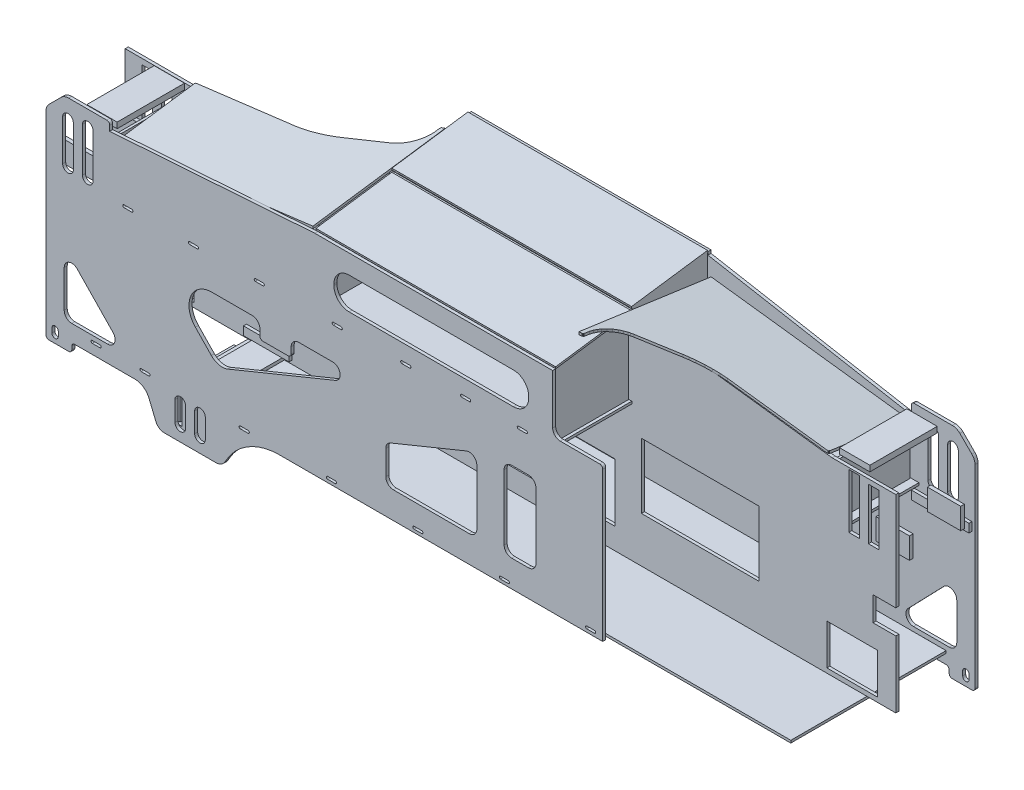
from build123d import *

# Parameters (mm, degrees)
EXTRUDE_1_DEPTH      = 260
CUT_EXTRUDE_1_DEPTH  = 600
CUT_EXTRUDE_1_DRAFT  = -7.939013706
CUT_EXTRUDE_3_DEPTH  = 600
CUT_EXTRUDE_3_TAPER  = 7.939013706
EXTRUDE_2_DEPTH      = 260
CUT_EXTRUDE_5_DEPTH  = 600
CUT_EXTRUDE_5_TAPER  = 7.939013706
CUT_EXTRUDE_10_DEPTH = 600
CUT_EXTRUDE_10_DRAFT = -7.939013706
EXTRUDE_3_DEPTH      = 10
SKETCH_20_W          = 690
SKETCH_20_H          = 192.4
SKETCH_20_W_2        = 642
SKETCH_20_H_2        = 130
SKETCH_20_W_3        = 388.2
SKETCH_20_H_3        = 214.6
SKETCH_20_W_4        = 167.3
SKETCH_20_H_4        = 133.9
SKETCH_20_W_5        = 35
SKETCH_20_H_5        = 180
SKETCH_20_H_6        = 170
SKETCH_20_W_6        = 75
SKETCH_20_H_7        = 80
CUT_EXTRUDE_14_DEPTH = 10
SKETCH_22_W          = 2040
SKETCH_22_H          = 8
EXTRUDE_4_DEPTH      = 512
EXTRUDE_5_DEPTH      = 251
EXTRUDE_6_DEPTH      = 251
EXTRUDE_7_DEPTH      = 790
EXTRUDE_8_DEPTH      = 790
EXTRUDE_10_DEPTH     = 10
SKETCH_35_R          = 110
SKETCH_35_R_2        = 40
CUT_EXTRUDE_18_DEPTH = 10
EXTRUDE_12_DEPTH     = 10
CUT_EXTRUDE_20_DEPTH = 10
EXTRUDE_13_DEPTH     = 8
EXTRUDE_14_DEPTH     = 8
EXTRUDE_15_DEPTH     = 8
SKETCH_47_W          = 243
SKETCH_47_H          = 172.5
EXTRUDE_16_DEPTH     = 8
SKETCH_49_W          = 243
SKETCH_49_H          = 172.5
EXTRUDE_17_DEPTH     = 8
SKETCH_53_W          = 222
SKETCH_53_H          = 19
EXTRUDE_18_DEPTH     = 100
SKETCH_55_W          = 222
SKETCH_55_H          = 19
EXTRUDE_19_DEPTH     = 100
SKETCH_57_W          = 110
SKETCH_57_H          = 70
EXTRUDE_20_DEPTH     = 12
SKETCH_59_W          = 110
SKETCH_59_H          = 70
EXTRUDE_21_DEPTH     = 12
SKETCH_61_W          = 110
SKETCH_61_H          = 70
EXTRUDE_22_DEPTH     = 12
SKETCH_63_W          = 110
SKETCH_63_H          = 70
EXTRUDE_23_DEPTH     = 12
SKETCH_65_W          = 170
SKETCH_65_H          = 206
EXTRUDE_24_DEPTH     = 10
SKETCH_70_W          = 9
SKETCH_70_H          = 130
EXTRUDE_25_DEPTH     = 120
SKETCH_72_W          = 188
SKETCH_72_H          = 122
EXTRUDE_26_DEPTH     = 10
SKETCH_74_W          = 188
SKETCH_74_H          = 122
EXTRUDE_27_DEPTH     = 10
SKETCH_76_W          = 188
SKETCH_76_H          = 122
EXTRUDE_28_DEPTH     = 10
CUT_EXTRUDE_26_DEPTH = 170
SKETCH_80_W          = 170
SKETCH_80_H          = 206
EXTRUDE_29_DEPTH     = 10
SKETCH_82_W          = 9
SKETCH_82_H          = 130
EXTRUDE_30_DEPTH     = 120
SKETCH_84_W          = 188
SKETCH_84_H          = 122
EXTRUDE_31_DEPTH     = 10
SKETCH_86_W          = 188
SKETCH_86_H          = 122
EXTRUDE_32_DEPTH     = 10
SKETCH_88_W          = 188
SKETCH_88_H          = 122
EXTRUDE_33_DEPTH     = 10
CUT_EXTRUDE_28_DEPTH = 170
SKETCH_92_W          = 150
SKETCH_92_H          = 28
EXTRUDE_34_DEPTH     = 10
SKETCH_94_W          = 150
SKETCH_94_H          = 28
EXTRUDE_35_DEPTH     = 10
SKETCH_96_W          = 150
SKETCH_96_H          = 28
EXTRUDE_36_DEPTH     = 10
SKETCH_98_W          = 150
SKETCH_98_H          = 28
EXTRUDE_38_DEPTH     = 10
SKETCH_99_W          = 190
SKETCH_99_H          = 28
EXTRUDE_39_DEPTH     = 10
SKETCH_100_W         = 190
SKETCH_100_H         = 28
EXTRUDE_40_DEPTH     = 10
SKETCH_101_W         = 190
SKETCH_101_H         = 28
EXTRUDE_41_DEPTH     = 10
SKETCH_102_W         = 190
SKETCH_102_H         = 28
EXTRUDE_43_DEPTH     = 10
SKETCH_104_W         = 100
SKETCH_104_H         = 251
EXTRUDE_44_DEPTH     = 10
SKETCH_105_W         = 100
SKETCH_105_H         = 251
EXTRUDE_46_DEPTH     = 10


with BuildPart() as part:
    # ｽｹｯﾁ2 → ﾎﾞｽ - 押し出し1 (new body)
    with BuildSketch(Plane(origin=(0, 700, 0), x_dir=(1, 0, 0), z_dir=(0, 1, 0))):
        Polygon((859.401578498, -89.242522878), (858.18844544, -92.043316668), (857.942098107, -109.59892495), (856.562944919, -120.633623225), (853.948200176, -131.420332107), (850.130416699, -141.825566927), (844.029861893, -153.62310181), (836.379229932, -164.464704914), (827.407372342, -174.070028252), (818.443138759, -181.486675677), (808.645526953, -187.779306007), (803.476676344, -190.47592951), (795.4371, -193.931622), (677.849128501, -238.310910325), (663.164273166, -243.339007562), (646.141609469, -248.370559614), (622.378346519, -254.026187714), (600.487925624, -257.882125504), (578.394815702, -260.501266552), (556.165277331, -261.87564156), (224.195193131, -262.101718981), (223.745858592, -263.826086479), (222.475446, -265.792122), (222.475446, -522), (869.5, -521.843193568), (869.5, -85.695096947), (861.419191022, -87.896224679), (859.520417297, -89.114243261), align=None)
    extrude(amount=EXTRUDE_1_DEPTH)


with BuildPart() as cut_extrude_1_tool:
    # ｽｹｯﾁ3 → ｶｯﾄ - 押し出し1 (with draft: the straight prism first)
    with BuildSketch(Plane.XY):
        Polygon((150, 808.1685), (950, 908.1685), (950, 1300), (150, 1300), align=None)
    extrude(amount=CUT_EXTRUDE_1_DEPTH)
    # ｶｯﾄ - 押し出し1: the draft: its side faces are tilted about the plane it starts from
    cut_extrude_1_sides = [cut_extrude_1_tool.faces().sort_by_distance(p)[0] for p in [
        (550, 858.1685, 300),
        (950, 1104.08425, 300),
        (550, 1300, 300),
        (150, 1054.08425, 300),
    ]]
    draft(cut_extrude_1_sides, Plane.XY, CUT_EXTRUDE_1_DRAFT)


with BuildPart() as part_1:
    add(part.part)

    # ｶｯﾄ - 押し出し1: cut by cut_extrude_1_tool
    add(cut_extrude_1_tool.part, mode=Mode.SUBTRACT)

    # ｽｹｯﾁ5 → ｶｯﾄ - 押し出し3 (cut)
    with BuildSketch(Plane.XY):
        Polygon((150, 800.028222948), (150, 300), (950, 300), (950, 900.028222948), align=None)
    extrude(amount=CUT_EXTRUDE_3_DEPTH, taper=CUT_EXTRUDE_3_TAPER, mode=Mode.SUBTRACT)

    # ｽｹｯﾁ15 → ﾎﾞｽ - 押し出し3 (add)
    with BuildSketch(Plane.XY.offset(261)):
        Polygon((0, 145), (2540, 145), (2540, 768.5), (2330, 768.5), (1660, 853), (880, 853), (218, 771.3), (0, 771.3), align=None)
    extrude(amount=EXTRUDE_3_DEPTH)

    # ｽｹｯﾁ20 → ｶｯﾄ - 押し出し14 (cut)
    with BuildSketch(Plane.XY.offset(261)):
        with Locations((1270, 311.2)):
            Rectangle(SKETCH_20_W, SKETCH_20_H)
        with Locations((1270, 725)):
            Rectangle(SKETCH_20_W_2, SKETCH_20_H_2)
        with Locations((644.6, 402.7)):
            Rectangle(SKETCH_20_W_3, SKETCH_20_H_3)
        with Locations((1895.4, 402.7)):
            Rectangle(SKETCH_20_W_3, SKETCH_20_H_3)
        with Locations((143.65, 226.95)):
            Rectangle(SKETCH_20_W_4, SKETCH_20_H_4)
        with Locations((2396.35, 226.95)):
            Rectangle(SKETCH_20_W_4, SKETCH_20_H_4)
        with Locations((2402.5, 673)):
            Rectangle(SKETCH_20_W_5, SKETCH_20_H_5)
        with Locations((137.5, 673)):
            Rectangle(SKETCH_20_W_5, SKETCH_20_H_5)
        with Locations((2467.5, 668)):
            Rectangle(SKETCH_20_W_5, SKETCH_20_H_6)
        with Locations((72.5, 668)):
            Rectangle(SKETCH_20_W_5, SKETCH_20_H_6)
        with Locations((37.5, 405)):
            Rectangle(SKETCH_20_W_6, SKETCH_20_H_7)
        with Locations((2502.5, 405)):
            Rectangle(SKETCH_20_W_6, SKETCH_20_H_7)
    extrude(amount=CUT_EXTRUDE_14_DEPTH, mode=Mode.SUBTRACT)

    # ｽｹｯﾁ22 → ﾎﾞｽ - 押し出し4 (add)
    with BuildSketch(Plane.XY.offset(10)):
        with Locations((1425, 141)):
            Rectangle(SKETCH_22_W, SKETCH_22_H)
    extrude(amount=EXTRUDE_4_DEPTH)

    # ｽｹｯﾁ23 → ﾎﾞｽ - 押し出し5 (add)
    with BuildSketch(Plane.XY.offset(10)):
        Polygon((870, 592.085859052), (2355, 571.35), (2355, 579.35), (870, 600.085859052), align=None)
    extrude(amount=EXTRUDE_5_DEPTH)

    # ｽｹｯﾁ25 → ﾎﾞｽ - 押し出し6 (add)
    with BuildSketch(Plane.XY.offset(271)):
        Polygon((185, 571.35), (1670, 592.085859052), (1670, 600.085859052), (185, 579.35), align=None)
    extrude(amount=EXTRUDE_6_DEPTH)

    # ｽｹｯﾁ31 → ﾎﾞｽ - 押し出し10 (add)
    with BuildSketch(Plane.XY):
        with BuildLine():
            Line((1770.99897, 127.000046), (869.999772, 127.000044))
            Line((869.999772, 127.000044), (869.999764, 544.000032))
            ThreePointArc((869.999764, 544.000032), (867.070831812, 551.071099812), (859.999764, 554.000032))
            Line((859.999764, 554.000032), (714.999756, 554.00003))
            ThreePointArc((714.999756, 554.00003), (707.928688188, 556.928962188), (704.999756, 564.00003))
            Line((704.999756, 564.00003), (704.999756, 619.000038))
            ThreePointArc((704.999756, 619.000038), (707.928688188, 626.071105812), (714.999756, 629.000038))
            Line((714.999756, 629.000038), (859.999764, 629.000036))
            ThreePointArc((859.999764, 629.000036), (867.070831812, 631.928968188), (869.999764, 639.000036))
            Line((869.999764, 639.000036), (869.999772, 891.50004))
            Line((869.999772, 891.50004), (1659.999756, 891.50004))
            Line((1659.999756, 891.50004), (1659.999756, 889.000038))
            Line((1659.999756, 889.000038), (1659.999756, 881.325972))
            Line((1659.999756, 881.325972), (2329.99977, 760.325976))
            Line((2329.99977, 760.325976), (2329.99976, 788.00004))
            ThreePointArc((2329.99976, 788.00004), (2332.928692188, 795.071107812), (2339.99976, 798.00004))
            Line((2339.99976, 798.00004), (2465.502294, 798.000038))
            ThreePointArc((2465.502294, 798.000038), (2478.896214133, 795.335821638), (2490.251031342, 787.748775342))
            Line((2490.251031342, 787.748775342), (2529.748503342, 748.251303342))
            ThreePointArc((2529.748503342, 748.251303342), (2537.335549638, 736.896486133), (2539.999766, 723.502566))
            Line((2539.999766, 723.502566), (2539.999768, 85.000032))
            ThreePointArc((2539.999768, 85.000032), (2537.070835812, 77.928964188), (2529.999768, 75.000032))
            Line((2529.999768, 75.000032), (2464.99977, 75.000032))
            ThreePointArc((2464.99977, 75.000032), (2457.928702188, 77.928964188), (2454.99977, 85.000032))
            Line((2454.99977, 85.000032), (2454.999772, 95.00004))
            ThreePointArc((2454.999772, 95.00004), (2452.070839812, 102.071107812), (2444.999772, 105.00004))
            Line((2444.999772, 105.00004), (2246.946474, 105.000044))
            ThreePointArc((2246.946474, 105.000044), (2219.167962349, 96.573524615), (2200.752497374, 74.134215618))
            Line((2200.752497374, 74.134215618), (2177.716155975, 18.519539029))
            ThreePointArc((2177.716155975, 18.519539029), (2166.666876991, 5.055953631), (2149.99977, 4.2e-05))
            Line((2149.99977, 4.2e-05), (1979.99976, 4.6e-05))
            ThreePointArc((1979.99976, 4.6e-05), (1962.49976, 4.689156868), (1949.688870868, 17.500046))
            Line((1949.688870868, 17.500046), (1944.204050757, 27.000046))
            ThreePointArc((1944.204050757, 27.000046), (1870.99897, 100.205126757), (1770.99897, 127.000046))
        make_face()
    extrude(amount=EXTRUDE_10_DEPTH)

    # ｽｹｯﾁ35 → ｶｯﾄ - 押し出し18 (cut)
    with BuildSketch(Plane.XY):
        with Locations((1069.99977, 730.000044)):
            Circle(SKETCH_35_R)
        with Locations((1719.999768, 648.223074)):
            Circle(SKETCH_35_R_2)
        with BuildLine():
            Line((2479.999762, 306.830088), (2479.999762, 185.00004))
            ThreePointArc((2479.999762, 185.00004), (2472.67743153, 167.32237047), (2454.999762, 160.00004))
            Line((2454.999762, 160.00004), (2337.304944, 160.00004))
            ThreePointArc((2337.304944, 160.00004), (2323.505525341, 164.153552414), (2314.291391219, 175.233956426))
            ThreePointArc((2314.291391219, 175.233956426), (2312.724223269, 189.559444387), (2319.324761616, 202.36992893))
            Line((2319.324761616, 202.36992893), (2437.019579616, 324.19997693))
            ThreePointArc((2437.019579616, 324.19997693), (2449.805467814, 331.284521298), (2464.36713731, 330.008791152))
            ThreePointArc((2464.36713731, 330.008791152), (2475.726367882, 320.808922308), (2479.999762, 306.830088))
        make_face()
        with BuildLine():
            Line((2419.999756, 745.500039924), (2419.999756, 600.500036076))
            ThreePointArc((2419.999756, 600.500036076), (2414.874106313, 588.125700971), (2402.499756, 583.000088))
            ThreePointArc((2402.499756, 583.000088), (2390.125405687, 588.125700971), (2384.999756, 600.500036076))
            Line((2384.999756, 600.500036076), (2384.999756, 745.500039924))
            ThreePointArc((2384.999756, 745.500039924), (2390.125405687, 757.874375029), (2402.499756, 762.999988))
            ThreePointArc((2402.499756, 762.999988), (2414.874106313, 757.874375029), (2419.999756, 745.500039924))
        make_face()
        with BuildLine():
            Line((2484.999772, 735.500031924), (2484.999772, 600.500036076))
            ThreePointArc((2484.999772, 600.500036076), (2479.874122313, 588.125700971), (2467.499772, 583.000088))
            ThreePointArc((2467.499772, 583.000088), (2455.125421687, 588.125700971), (2449.999772, 600.500036076))
            Line((2449.999772, 600.500036076), (2449.999772, 735.500031924))
            ThreePointArc((2449.999772, 735.500031924), (2455.125421687, 747.874367029), (2467.499772, 752.99998))
            ThreePointArc((2467.499772, 752.99998), (2479.874122313, 747.874367029), (2484.999772, 735.500031924))
        make_face()
        with BuildLine():
            Line((2014.999766, 47.500040076), (2014.999766, 112.500033924))
            ThreePointArc((2014.999766, 112.500033924), (2020.125415687, 124.874369029), (2032.499766, 129.999982))
            ThreePointArc((2032.499766, 129.999982), (2044.874116313, 124.874369029), (2049.999766, 112.500033924))
            Line((2049.999766, 112.500033924), (2049.999766, 47.500040076))
            ThreePointArc((2049.999766, 47.500040076), (2044.874116313, 35.125704971), (2032.499766, 30.000092))
            ThreePointArc((2032.499766, 30.000092), (2020.125415687, 35.125704971), (2014.999766, 47.500040076))
        make_face()
        with BuildLine():
            Line((2079.999764, 47.500040076), (2079.999764, 112.500033924))
            ThreePointArc((2079.999764, 112.500033924), (2085.125413687, 124.874369029), (2097.499764, 129.999982))
            ThreePointArc((2097.499764, 129.999982), (2109.874114313, 124.874369029), (2114.999764, 112.500033924))
            Line((2114.999764, 112.500033924), (2114.999764, 47.500040076))
            ThreePointArc((2114.999764, 47.500040076), (2109.874114313, 35.125704971), (2097.499764, 30.000092))
            ThreePointArc((2097.499764, 30.000092), (2085.125413687, 35.125704971), (2079.999764, 47.500040076))
        make_face()
        with BuildLine():
            Line((2499.49977, 100.000044), (2499.49977, 115.000038))
            ThreePointArc((2499.49977, 115.000038), (2502.575148798, 122.424659202), (2509.99977, 125.500038))
            ThreePointArc((2509.99977, 125.500038), (2517.424391202, 122.424659202), (2520.49977, 115.000038))
            Line((2520.49977, 115.000038), (2520.49977, 100.000044))
            ThreePointArc((2520.49977, 100.000044), (2517.424391202, 92.575422798), (2509.99977, 89.500044))
            ThreePointArc((2509.99977, 89.500044), (2502.575148798, 92.575422798), (2499.49977, 100.000044))
        make_face()
        with BuildLine():
            Line((907.35, 136.85), (932.65, 136.85))
            ThreePointArc((932.65, 136.85), (935.584493142, 138.065506858), (936.8, 141))
            ThreePointArc((936.8, 141), (935.584493142, 143.934493142), (932.65, 145.15))
            Line((932.65, 145.15), (907.35, 145.15))
            ThreePointArc((907.35, 145.15), (904.415506858, 143.934493142), (903.2, 141))
            ThreePointArc((903.2, 141), (904.415506858, 138.065506858), (907.35, 136.85))
        make_face()
        with BuildLine():
            Line((1148.35, 136.85), (1173.65, 136.85))
            ThreePointArc((1173.65, 136.85), (1176.584493142, 138.065506858), (1177.8, 141))
            ThreePointArc((1177.8, 141), (1176.584493142, 143.934493142), (1173.65, 145.15))
            Line((1173.65, 145.15), (1148.35, 145.15))
            ThreePointArc((1148.35, 145.15), (1145.415506858, 143.934493142), (1144.2, 141))
            ThreePointArc((1144.2, 141), (1145.415506858, 138.065506858), (1148.35, 136.85))
        make_face()
        with BuildLine():
            Line((1390.35, 136.85), (1415.65, 136.85))
            ThreePointArc((1415.65, 136.85), (1418.584493142, 138.065506858), (1419.8, 141))
            ThreePointArc((1419.8, 141), (1418.584493142, 143.934493142), (1415.65, 145.15))
            Line((1415.65, 145.15), (1390.35, 145.15))
            ThreePointArc((1390.35, 145.15), (1387.415506858, 143.934493142), (1386.2, 141))
            ThreePointArc((1386.2, 141), (1387.415506858, 138.065506858), (1390.35, 136.85))
        make_face()
        with BuildLine():
            Line((1632.35, 136.85), (1657.65, 136.85))
            ThreePointArc((1657.65, 136.85), (1660.584493142, 138.065506858), (1661.8, 141))
            ThreePointArc((1661.8, 141), (1660.584493142, 143.934493142), (1657.65, 145.15))
            Line((1657.65, 145.15), (1632.35, 145.15))
            ThreePointArc((1632.35, 145.15), (1629.415506858, 143.934493142), (1628.2, 141))
            ThreePointArc((1628.2, 141), (1629.415506858, 138.065506858), (1632.35, 136.85))
        make_face()
        with BuildLine():
            Line((1873.85, 136.85), (1899.15, 136.85))
            ThreePointArc((1899.15, 136.85), (1902.084493142, 138.065506858), (1903.3, 141))
            ThreePointArc((1903.3, 141), (1902.084493142, 143.934493142), (1899.15, 145.15))
            Line((1899.15, 145.15), (1873.85, 145.15))
            ThreePointArc((1873.85, 145.15), (1870.915506858, 143.934493142), (1869.7, 141))
            ThreePointArc((1869.7, 141), (1870.915506858, 138.065506858), (1873.85, 136.85))
        make_face()
        with BuildLine():
            Line((2200.85, 136.85), (2226.15, 136.85))
            ThreePointArc((2226.15, 136.85), (2229.084493142, 138.065506858), (2230.3, 141))
            ThreePointArc((2230.3, 141), (2229.084493142, 143.934493142), (2226.15, 145.15))
            Line((2226.15, 145.15), (2200.85, 145.15))
            ThreePointArc((2200.85, 145.15), (2197.915506858, 143.934493142), (2196.7, 141))
            ThreePointArc((2196.7, 141), (2197.915506858, 138.065506858), (2200.85, 136.85))
        make_face()
        with BuildLine():
            Line((2362.35, 136.85), (2387.65, 136.85))
            ThreePointArc((2387.65, 136.85), (2390.584493142, 138.065506858), (2391.8, 141))
            ThreePointArc((2391.8, 141), (2390.584493142, 143.934493142), (2387.65, 145.15))
            Line((2387.65, 145.15), (2362.35, 145.15))
            ThreePointArc((2362.35, 145.15), (2359.415506858, 143.934493142), (2358.2, 141))
            ThreePointArc((2358.2, 141), (2359.415506858, 138.065506858), (2362.35, 136.85))
        make_face()
        with BuildLine():
            Line((907.35, 595.351), (932.65, 595.351))
            ThreePointArc((932.65, 595.351), (935.584493142, 596.566506858), (936.8, 599.501))
            ThreePointArc((936.8, 599.501), (935.584493142, 602.435493142), (932.65, 603.651))
            Line((932.65, 603.651), (907.35, 603.651))
            ThreePointArc((907.35, 603.651), (904.415506858, 602.435493142), (903.2, 599.501))
            ThreePointArc((903.2, 599.501), (904.415506858, 596.566506858), (907.35, 595.351))
        make_face()
        with BuildLine():
            Line((1132.35, 592.209), (1157.65, 592.209))
            ThreePointArc((1157.65, 592.209), (1160.584493142, 593.424506858), (1161.8, 596.359))
            ThreePointArc((1161.8, 596.359), (1160.584493142, 599.293493142), (1157.65, 600.509))
            Line((1157.65, 600.509), (1132.35, 600.509))
            ThreePointArc((1132.35, 600.509), (1129.415506858, 599.293493142), (1128.2, 596.359))
            ThreePointArc((1128.2, 596.359), (1129.415506858, 593.424506858), (1132.35, 592.209))
        make_face()
        with BuildLine():
            Line((1329.35, 589.458), (1354.65, 589.458))
            ThreePointArc((1354.65, 589.458), (1357.584493142, 590.673506858), (1358.8, 593.608))
            ThreePointArc((1358.8, 593.608), (1357.584493142, 596.542493142), (1354.65, 597.758))
            Line((1354.65, 597.758), (1329.35, 597.758))
            ThreePointArc((1329.35, 597.758), (1326.415506858, 596.542493142), (1325.2, 593.608))
            ThreePointArc((1325.2, 593.608), (1326.415506858, 590.673506858), (1329.35, 589.458))
        make_face()
        with BuildLine():
            Line((1603.35, 585.632), (1628.65, 585.632))
            ThreePointArc((1628.65, 585.632), (1631.584493142, 586.847506858), (1632.8, 589.782))
            ThreePointArc((1632.8, 589.782), (1631.584493142, 592.716493142), (1628.65, 593.932))
            Line((1628.65, 593.932), (1603.35, 593.932))
            ThreePointArc((1603.35, 593.932), (1600.415506858, 592.716493142), (1599.2, 589.782))
            ThreePointArc((1599.2, 589.782), (1600.415506858, 586.847506858), (1603.35, 585.632))
        make_face()
        with BuildLine():
            Line((1808.35, 582.77), (1833.65, 582.77))
            ThreePointArc((1833.65, 582.77), (1836.584493142, 583.985506858), (1837.8, 586.92))
            ThreePointArc((1837.8, 586.92), (1836.584493142, 589.854493142), (1833.65, 591.07))
            Line((1833.65, 591.07), (1808.35, 591.07))
            ThreePointArc((1808.35, 591.07), (1805.415506858, 589.854493142), (1804.2, 586.92))
            ThreePointArc((1804.2, 586.92), (1805.415506858, 583.985506858), (1808.35, 582.77))
        make_face()
        with BuildLine():
            Line((2033.35, 579.628), (2058.65, 579.628))
            ThreePointArc((2058.65, 579.628), (2061.584493142, 580.843506858), (2062.8, 583.778))
            ThreePointArc((2062.8, 583.778), (2061.584493142, 586.712493142), (2058.65, 587.928))
            Line((2058.65, 587.928), (2033.35, 587.928))
            ThreePointArc((2033.35, 587.928), (2030.415506858, 586.712493142), (2029.2, 583.778))
            ThreePointArc((2029.2, 583.778), (2030.415506858, 580.843506858), (2033.35, 579.628))
        make_face()
        with BuildLine():
            Line((2257.35, 576.5), (2282.65, 576.5))
            ThreePointArc((2282.65, 576.5), (2285.584493142, 577.715506858), (2286.8, 580.65))
            ThreePointArc((2286.8, 580.65), (2285.584493142, 583.584493142), (2282.65, 584.8))
            Line((2282.65, 584.8), (2257.35, 584.8))
            ThreePointArc((2257.35, 584.8), (2254.415506858, 583.584493142), (2253.2, 580.65))
            ThreePointArc((2253.2, 580.65), (2254.415506858, 577.715506858), (2257.35, 576.5))
        make_face()
    extrude(amount=CUT_EXTRUDE_18_DEPTH, mode=Mode.SUBTRACT)



with BuildPart() as body_2:
    # ｽｹｯﾁ6 → ﾎﾞｽ - 押し出し2 (new body)
    with BuildSketch(Plane(origin=(0, 700, 0), x_dir=(1, 0, 0), z_dir=(0, 1, 0))):
        Polygon((1680.598421502, -442.757477122), (1681.81155456, -439.956683332), (1682.057901893, -422.40107505), (1683.437055081, -411.366376775), (1686.051799824, -400.579667893), (1689.869583301, -390.174433073), (1695.970138107, -378.37689819), (1703.620770068, -367.535295086), (1712.592627658, -357.929971748), (1721.556861241, -350.513324323), (1731.354473047, -344.220693993), (1736.523323656, -341.52407049), (1744.5629, -338.068378), (1862.150871499, -293.689089675), (1876.835726834, -288.660992438), (1893.858390531, -283.629440386), (1917.621653481, -277.973812286), (1939.512074376, -274.117874496), (1961.605184298, -271.498733448), (1983.834722669, -270.12435844), (2315.804806869, -269.898281019), (2316.254141408, -268.173913521), (2317.524554, -266.207878), (2317.524554, -10), (1670.5, -10.156806432), (1670.5, -446.304903053), (1678.580808978, -444.103775321), (1680.479582703, -442.885756739), align=None)
    extrude(amount=EXTRUDE_2_DEPTH)

    # ｽｹｯﾁ8 → ｶｯﾄ - 押し出し5 (cut)
    with BuildSketch(Plane.XY):
        Polygon((1590, 833.401), (2390, 733.401), (2390, 1300), (1590, 1300), align=None)
    extrude(amount=CUT_EXTRUDE_5_DEPTH, taper=CUT_EXTRUDE_5_TAPER, mode=Mode.SUBTRACT)


with BuildPart() as cut_extrude_10_tool:
    # ｽｹｯﾁ13 → ｶｯﾄ - 押し出し10 (with draft: the straight prism first)
    with BuildSketch(Plane.XY):
        Polygon((1590, 825.260722948), (1590, 300), (2390, 300), (2390, 725.260722948), align=None)
    extrude(amount=CUT_EXTRUDE_10_DEPTH)
    # ｶｯﾄ - 押し出し10: the draft: its side faces are tilted about the plane it starts from
    cut_extrude_10_sides = [cut_extrude_10_tool.faces().sort_by_distance(p)[0] for p in [
        (1590, 562.630361474, 300),
        (1990, 300, 300),
        (2390, 512.630361474, 300),
        (1990, 775.260722948, 300),
    ]]
    draft(cut_extrude_10_sides, Plane.XY, CUT_EXTRUDE_10_DRAFT)


with BuildPart() as body_2_1:
    add(body_2.part)

    # ｶｯﾄ - 押し出し10: cut by cut_extrude_10_tool
    add(cut_extrude_10_tool.part, mode=Mode.SUBTRACT)


with BuildPart() as body_3:
    # ｽｹｯﾁ27 → ﾎﾞｽ - 押し出し7 (new body)
    with BuildSketch(Plane(origin=(870, 0, 0), x_dir=(0, 0, -1), z_dir=(1, 0, 0))):
        Polygon((-11.335, 895.757969639), (-261.873, 860.547149994), (-261.037961394, 854.605541582), (-10.499961394, 889.816361226), align=None)
    extrude(amount=EXTRUDE_7_DEPTH)



with BuildPart() as body_4:
    # ｽｹｯﾁ29 → ﾎﾞｽ - 押し出し8 (new body)
    with BuildSketch(Plane(origin=(880, 0, 0), x_dir=(0, 0, -1), z_dir=(1, 0, 0))):
        Polygon((-272.292, 859.082855037), (-522.335, 823.941603106), (-521.499961394, 817.999994693), (-271.456961394, 853.141246625), align=None)
    extrude(amount=EXTRUDE_8_DEPTH)


with BuildPart() as body_5:
    # ｽｹｯﾁ37 → ﾎﾞｽ - 押し出し12 (new body)
    with BuildSketch(Plane.XY.offset(522)):
        with BuildLine():
            Line((769.000788, 127.000046), (1834.999992, 127.000044))
            Line((1834.999992, 127.000044), (1834.999984, 619.000038))
            ThreePointArc((1834.999984, 619.000038), (1832.071051812, 626.071105812), (1824.999984, 629.000038))
            Line((1824.999984, 629.000038), (1694.999988, 629.00003))
            ThreePointArc((1694.999988, 629.00003), (1677.32231847, 636.32236047), (1669.999988, 654.00003))
            Line((1669.999988, 654.00003), (1669.999986, 818.000046))
            Line((1669.999986, 818.000046), (886.199994, 818.000046))
            Line((886.199994, 818.000046), (209.999988, 770.800032))
            Line((209.999988, 770.800032), (209.999998, 788.00004))
            ThreePointArc((209.999998, 788.00004), (207.071065812, 795.071107812), (199.999998, 798.00004))
            Line((199.999998, 798.00004), (74.497464, 798.000038))
            ThreePointArc((74.497464, 798.000038), (61.103543867, 795.335821638), (49.748726658, 787.748775342))
            Line((49.748726658, 787.748775342), (10.251254658, 748.251303342))
            ThreePointArc((10.251254658, 748.251303342), (2.664208362, 736.896486133), (-8e-06, 723.502566))
            Line((-8e-06, 723.502566), (-1e-05, 85.000032))
            ThreePointArc((-1e-05, 85.000032), (2.928922188, 77.928964188), (9.99999, 75.000032))
            Line((9.99999, 75.000032), (74.999988, 75.000032))
            ThreePointArc((74.999988, 75.000032), (82.071055812, 77.928964188), (84.999988, 85.000032))
            Line((84.999988, 85.000032), (84.999986, 95.00004))
            ThreePointArc((84.999986, 95.00004), (87.928918188, 102.071107812), (94.999986, 105.00004))
            Line((94.999986, 105.00004), (293.053284, 105.000044))
            ThreePointArc((293.053284, 105.000044), (320.831795651, 96.573524615), (339.247260626, 74.134215618))
            Line((339.247260626, 74.134215618), (362.283602025, 18.519539029))
            ThreePointArc((362.283602025, 18.519539029), (373.332881009, 5.055953631), (389.999988, 4.2e-05))
            Line((389.999988, 4.2e-05), (559.999998, 4.6e-05))
            ThreePointArc((559.999998, 4.6e-05), (577.499998, 4.689156868), (590.310887132, 17.500046))
            Line((590.310887132, 17.500046), (595.795707243, 27.000046))
            ThreePointArc((595.795707243, 27.000046), (669.000788, 100.205126757), (769.000788, 127.000046))
        make_face()
    extrude(amount=EXTRUDE_12_DEPTH)

    # ｽｹｯﾁ39 → ｶｯﾄ - 押し出し20 (cut)
    with BuildSketch(Plane.XY.offset(522)):
        with BuildLine():
            Line((1590.999998, 700.000044981), (1590.999998, 705.000047236))
            ThreePointArc((1590.999998, 705.000047236), (1576.355335208, 740.355382911), (1540.999998, 755.000042))
            Line((1540.999998, 755.000042), (999, 755.000042))
            ThreePointArc((999, 755.000042), (963.644660941, 740.355381059), (949, 705.000042))
            Line((949, 705.000042), (949, 700.000043236))
            ThreePointArc((949, 700.000043236), (963.644659089, 664.644700792), (999, 650.000038))
            Line((999, 650.000038), (1541.000004109, 650.000038))
            ThreePointArc((1541.000004109, 650.000038), (1576.355341687, 664.644703569), (1590.999998, 700.000044981))
        make_face()
        with BuildLine():
            Line((492.389512848, 352.89036921), (544.869989232, 298.56598814))
            ThreePointArc((544.869989232, 298.56598814), (570.539750908, 284.376189178), (599.750661652, 287.023782914))
            Line((599.750661652, 287.023782914), (954.039979826, 431.859048457))
            ThreePointArc((954.039979826, 431.859048457), (966.586843624, 443.138708908), (969.110671772, 459.820579982))
            ThreePointArc((969.110671772, 459.820579982), (960.46199368, 474.306949379), (944.579826, 480.00004))
            Line((944.579826, 480.00004), (832.999986, 480.00004))
            ThreePointArc((832.999986, 480.00004), (815.32231647, 472.67770953), (807.999986, 455.00004))
            Line((807.999986, 455.00004), (807.999994, 434.000034))
            ThreePointArc((807.999994, 434.000034), (805.071061812, 426.928966188), (797.999994, 424.000034))
            Line((797.999994, 424.000034), (714.999996, 424.000034))
            ThreePointArc((714.999996, 424.000034), (707.928928188, 426.928966188), (704.999996, 434.000034))
            Line((704.999996, 434.000034), (704.999986, 455.00004))
            ThreePointArc((704.999986, 455.00004), (697.67765553, 472.67770953), (679.999986, 480.00004))
            Line((679.999986, 480.00004), (546.33006, 480.000036))
            ThreePointArc((546.33006, 480.000036), (504.931804023, 467.539498758), (477.289401656, 434.298286722))
            ThreePointArc((477.289401656, 434.298286722), (472.587897808, 391.321822839), (492.389512848, 352.89036921))
        make_face()
        with BuildLine():
            Line((1119.999998, 320.866002), (1119.999998, 240.00003))
            ThreePointArc((1119.999998, 240.00003), (1127.32232847, 222.32236047), (1144.999998, 215.00003))
            Line((1144.999998, 215.00003), (1395, 215.00003))
            ThreePointArc((1395, 215.00003), (1412.67766953, 222.32236047), (1420, 240.00003))
            Line((1420, 240.00003), (1420, 423.067266))
            ThreePointArc((1420, 423.067266), (1417.061644001, 434.82668197), (1408.937290884, 443.821829904))
            ThreePointArc((1408.937290884, 443.821829904), (1397.536719984, 447.93823405), (1385.539846174, 446.208257543))
            Line((1385.539846174, 446.208257543), (1135.539844174, 344.006993543))
            ThreePointArc((1135.539844174, 344.006993543), (1124.245434096, 334.803292884), (1119.999998, 320.866002))
        make_face()
        with BuildLine():
            Line((1509.999986, 455.00004), (1509.999986, 240.00003))
            ThreePointArc((1509.999986, 240.00003), (1517.32231647, 222.32236047), (1534.999986, 215.00003))
            Line((1534.999986, 215.00003), (1589.999994, 215.00003))
            ThreePointArc((1589.999994, 215.00003), (1607.67766353, 222.32236047), (1614.999994, 240.00003))
            Line((1614.999994, 240.00003), (1614.999994, 455.00004))
            ThreePointArc((1614.999994, 455.00004), (1607.67766353, 472.67770953), (1589.999994, 480.00004))
            Line((1589.999994, 480.00004), (1534.999986, 480.00004))
            ThreePointArc((1534.999986, 480.00004), (1517.32231647, 472.67770953), (1509.999986, 455.00004))
        make_face()
        with BuildLine():
            Line((220.674996384, 202.36992893), (102.980178384, 324.19997693))
            ThreePointArc((102.980178384, 324.19997693), (90.194290186, 331.284521298), (75.63262069, 330.008791152))
            ThreePointArc((75.63262069, 330.008791152), (64.273390118, 320.808922308), (59.999996, 306.830088))
            Line((59.999996, 306.830088), (59.999996, 185.00004))
            ThreePointArc((59.999996, 185.00004), (67.32232647, 167.32237047), (84.999996, 160.00004))
            Line((84.999996, 160.00004), (202.694814, 160.00004))
            ThreePointArc((202.694814, 160.00004), (216.494232659, 164.153552414), (225.708366781, 175.233956426))
            ThreePointArc((225.708366781, 175.233956426), (227.275534731, 189.559444387), (220.674996384, 202.36992893))
        make_face()
        with BuildLine():
            Line((119.999984, 745.500039924), (119.999984, 600.500036076))
            ThreePointArc((119.999984, 600.500036076), (125.125633687, 588.125700971), (137.499984, 583.000088))
            ThreePointArc((137.499984, 583.000088), (149.874334313, 588.125700971), (154.999984, 600.500036076))
            Line((154.999984, 600.500036076), (154.999984, 745.500039924))
            ThreePointArc((154.999984, 745.500039924), (149.874334313, 757.874375029), (137.499984, 762.999988))
            ThreePointArc((137.499984, 762.999988), (125.125633687, 757.874375029), (119.999984, 745.500039924))
        make_face()
        with BuildLine():
            Line((54.999986, 735.500031924), (54.999986, 600.500036076))
            ThreePointArc((54.999986, 600.500036076), (60.125635687, 588.125700971), (72.499986, 583.000088))
            ThreePointArc((72.499986, 583.000088), (84.874336313, 588.125700971), (89.999986, 600.500036076))
            Line((89.999986, 600.500036076), (89.999986, 735.500031924))
            ThreePointArc((89.999986, 735.500031924), (84.874336313, 747.874367029), (72.499986, 752.99998))
            ThreePointArc((72.499986, 752.99998), (60.125635687, 747.874367029), (54.999986, 735.500031924))
        make_face()
        with BuildLine():
            Line((459.999994, 47.500040076), (459.999994, 112.500033924))
            ThreePointArc((459.999994, 112.500033924), (454.874344313, 124.874369029), (442.499994, 129.999982))
            ThreePointArc((442.499994, 129.999982), (430.125643687, 124.874369029), (424.999994, 112.500033924))
            Line((424.999994, 112.500033924), (424.999994, 47.500040076))
            ThreePointArc((424.999994, 47.500040076), (430.125643687, 35.125704971), (442.499994, 30.000092))
            ThreePointArc((442.499994, 30.000092), (454.874344313, 35.125704971), (459.999994, 47.500040076))
        make_face()
        with BuildLine():
            Line((524.999992, 47.500040076), (524.999992, 112.500033924))
            ThreePointArc((524.999992, 112.500033924), (519.874342313, 124.874369029), (507.499992, 129.999982))
            ThreePointArc((507.499992, 129.999982), (495.125641687, 124.874369029), (489.999992, 112.500033924))
            Line((489.999992, 112.500033924), (489.999992, 47.500040076))
            ThreePointArc((489.999992, 47.500040076), (495.125641687, 35.125704971), (507.499992, 30.000092))
            ThreePointArc((507.499992, 30.000092), (519.874342313, 35.125704971), (524.999992, 47.500040076))
        make_face()
        with BuildLine():
            Line((19.499988, 115.000038), (19.499988, 100.000044))
            ThreePointArc((19.499988, 100.000044), (22.575366798, 92.575422798), (29.999988, 89.500044))
            ThreePointArc((29.999988, 89.500044), (37.424609202, 92.575422798), (40.499988, 100.000044))
            Line((40.499988, 100.000044), (40.499988, 115.000038))
            ThreePointArc((40.499988, 115.000038), (37.424609202, 122.424659202), (29.999988, 125.500038))
            ThreePointArc((29.999988, 125.500038), (22.575366798, 122.424659202), (19.499988, 115.000038))
        make_face()
        with BuildLine():
            Line((152.35, 136.85), (177.65, 136.85))
            ThreePointArc((177.65, 136.85), (180.584493142, 138.065506858), (181.8, 141))
            ThreePointArc((181.8, 141), (180.584493142, 143.934493142), (177.65, 145.15))
            Line((177.65, 145.15), (152.35, 145.15))
            ThreePointArc((152.35, 145.15), (149.415506858, 143.934493142), (148.2, 141))
            ThreePointArc((148.2, 141), (149.415506858, 138.065506858), (152.35, 136.85))
        make_face()
        with BuildLine():
            Line((313.85, 136.85), (339.15, 136.85))
            ThreePointArc((339.15, 136.85), (342.084493142, 138.065506858), (343.3, 141))
            ThreePointArc((343.3, 141), (342.084493142, 143.934493142), (339.15, 145.15))
            Line((339.15, 145.15), (313.85, 145.15))
            ThreePointArc((313.85, 145.15), (310.915506858, 143.934493142), (309.7, 141))
            ThreePointArc((309.7, 141), (310.915506858, 138.065506858), (313.85, 136.85))
        make_face()
        with BuildLine():
            Line((640.85, 136.85), (666.15, 136.85))
            ThreePointArc((666.15, 136.85), (669.084493142, 138.065506858), (670.3, 141))
            ThreePointArc((670.3, 141), (669.084493142, 143.934493142), (666.15, 145.15))
            Line((666.15, 145.15), (640.85, 145.15))
            ThreePointArc((640.85, 145.15), (637.915506858, 143.934493142), (636.7, 141))
            ThreePointArc((636.7, 141), (637.915506858, 138.065506858), (640.85, 136.85))
        make_face()
        with BuildLine():
            Line((928.35, 136.85), (953.65, 136.85))
            ThreePointArc((953.65, 136.85), (956.584493142, 138.065506858), (957.8, 141))
            ThreePointArc((957.8, 141), (956.584493142, 143.934493142), (953.65, 145.15))
            Line((953.65, 145.15), (928.35, 145.15))
            ThreePointArc((928.35, 145.15), (925.415506858, 143.934493142), (924.2, 141))
            ThreePointArc((924.2, 141), (925.415506858, 138.065506858), (928.35, 136.85))
        make_face()
        with BuildLine():
            Line((1213.35, 136.85), (1238.65, 136.85))
            ThreePointArc((1238.65, 136.85), (1241.584493142, 138.065506858), (1242.8, 141))
            ThreePointArc((1242.8, 141), (1241.584493142, 143.934493142), (1238.65, 145.15))
            Line((1238.65, 145.15), (1213.35, 145.15))
            ThreePointArc((1213.35, 145.15), (1210.415506858, 143.934493142), (1209.2, 141))
            ThreePointArc((1209.2, 141), (1210.415506858, 138.065506858), (1213.35, 136.85))
        make_face()
        with BuildLine():
            Line((1498.35, 136.85), (1523.65, 136.85))
            ThreePointArc((1523.65, 136.85), (1526.584493142, 138.065506858), (1527.8, 141))
            ThreePointArc((1527.8, 141), (1526.584493142, 143.934493142), (1523.65, 145.15))
            Line((1523.65, 145.15), (1498.35, 145.15))
            ThreePointArc((1498.35, 145.15), (1495.415506858, 143.934493142), (1494.2, 141))
            ThreePointArc((1494.2, 141), (1495.415506858, 138.065506858), (1498.35, 136.85))
        make_face()
        with BuildLine():
            Line((1782.35, 136.85), (1807.65, 136.85))
            ThreePointArc((1807.65, 136.85), (1810.584493142, 138.065506858), (1811.8, 141))
            ThreePointArc((1811.8, 141), (1810.584493142, 143.934493142), (1807.65, 145.15))
            Line((1807.65, 145.15), (1782.35, 145.15))
            ThreePointArc((1782.35, 145.15), (1779.415506858, 143.934493142), (1778.2, 141))
            ThreePointArc((1778.2, 141), (1779.415506858, 138.065506858), (1782.35, 136.85))
        make_face()
        with BuildLine():
            Line((257.35, 576.5), (282.65, 576.5))
            ThreePointArc((282.65, 576.5), (285.584493142, 577.715506858), (286.8, 580.65))
            ThreePointArc((286.8, 580.65), (285.584493142, 583.584493142), (282.65, 584.8))
            Line((282.65, 584.8), (257.35, 584.8))
            ThreePointArc((257.35, 584.8), (254.415506858, 583.584493142), (253.2, 580.65))
            ThreePointArc((253.2, 580.65), (254.415506858, 577.715506858), (257.35, 576.5))
        make_face()
        with BuildLine():
            Line((473.35, 579.516), (498.65, 579.516))
            ThreePointArc((498.65, 579.516), (501.584493142, 580.731506858), (502.8, 583.666))
            ThreePointArc((502.8, 583.666), (501.584493142, 586.600493142), (498.65, 587.816))
            Line((498.65, 587.816), (473.35, 587.816))
            ThreePointArc((473.35, 587.816), (470.415506858, 586.600493142), (469.2, 583.666))
            ThreePointArc((469.2, 583.666), (470.415506858, 580.731506858), (473.35, 579.516))
        make_face()
        with BuildLine():
            Line((690.35, 582.546), (715.65, 582.546))
            ThreePointArc((715.65, 582.546), (718.584493142, 583.761506858), (719.8, 586.696))
            ThreePointArc((719.8, 586.696), (718.584493142, 589.630493142), (715.65, 590.846))
            Line((715.65, 590.846), (690.35, 590.846))
            ThreePointArc((690.35, 590.846), (687.415506858, 589.630493142), (686.2, 586.696))
            ThreePointArc((686.2, 586.696), (687.415506858, 583.761506858), (690.35, 582.546))
        make_face()
        with BuildLine():
            Line((947.35, 586.135), (972.65, 586.135))
            ThreePointArc((972.65, 586.135), (975.584493142, 587.350506858), (976.8, 590.285))
            ThreePointArc((976.8, 590.285), (975.584493142, 593.219493142), (972.65, 594.435))
            Line((972.65, 594.435), (947.35, 594.435))
            ThreePointArc((947.35, 594.435), (944.415506858, 593.219493142), (943.2, 590.285))
            ThreePointArc((943.2, 590.285), (944.415506858, 587.350506858), (947.35, 586.135))
        make_face()
        with BuildLine():
            Line((1173.35, 589.291), (1198.65, 589.291))
            ThreePointArc((1198.65, 589.291), (1201.584493142, 590.506506858), (1202.8, 593.441))
            ThreePointArc((1202.8, 593.441), (1201.584493142, 596.375493142), (1198.65, 597.591))
            Line((1198.65, 597.591), (1173.35, 597.591))
            ThreePointArc((1173.35, 597.591), (1170.415506858, 596.375493142), (1169.2, 593.441))
            ThreePointArc((1169.2, 593.441), (1170.415506858, 590.506506858), (1173.35, 589.291))
        make_face()
        with BuildLine():
            Line((1370.35, 592.041), (1395.65, 592.041))
            ThreePointArc((1395.65, 592.041), (1398.584493142, 593.256506858), (1399.8, 596.191))
            ThreePointArc((1399.8, 596.191), (1398.584493142, 599.125493142), (1395.65, 600.341))
            Line((1395.65, 600.341), (1370.35, 600.341))
            ThreePointArc((1370.35, 600.341), (1367.415506858, 599.125493142), (1366.2, 596.191))
            ThreePointArc((1366.2, 596.191), (1367.415506858, 593.256506858), (1370.35, 592.041))
        make_face()
        with BuildLine():
            Line((1557.35, 594.653), (1582.65, 594.653))
            ThreePointArc((1582.65, 594.653), (1585.584493142, 595.868506858), (1586.8, 598.803))
            ThreePointArc((1586.8, 598.803), (1585.584493142, 601.737493142), (1582.65, 602.953))
            Line((1582.65, 602.953), (1557.35, 602.953))
            ThreePointArc((1557.35, 602.953), (1554.415506858, 601.737493142), (1553.2, 598.803))
            ThreePointArc((1553.2, 598.803), (1554.415506858, 595.868506858), (1557.35, 594.653))
        make_face()
    extrude(amount=CUT_EXTRUDE_20_DEPTH, mode=Mode.SUBTRACT)


with BuildPart() as body_3_1:
    add(body_3.part)

    add(body_4.part)  # ﾎﾞｽ - 押し出し13 merges body 4
    # ｽｹｯﾁ41 → ﾎﾞｽ - 押し出し13 (add)
    with BuildSketch(Plane(origin=(880, 0, 0), x_dir=(0, 0, -1), z_dir=(1, 0, 0))):
        Polygon((-11, 601), (-260, 601), (-260, 854.751417542), (-11, 889.746085383), align=None)
        Polygon((-272, 601), (-521, 601), (-521, 818.070259685), (-272, 853.064927526), align=None)
    extrude(amount=EXTRUDE_13_DEPTH)


with BuildPart() as part_2:
    add(part_1.part)

    add(body_3_1.part)  # ﾎﾞｽ - 押し出し14 merges body 3
    # ｽｹｯﾁ43 → ﾎﾞｽ - 押し出し14 (add)
    with BuildSketch(Plane(origin=(1652, 0, 0), x_dir=(0, 0, -1), z_dir=(1, 0, 0))):
        Polygon((-11, 590), (-260, 590), (-260, 854.751417542), (-11, 889.746085383), align=None)
        Polygon((-272, 590), (-521, 590), (-521, 818.070259685), (-272, 853.064927526), align=None)
    extrude(amount=EXTRUDE_14_DEPTH)

    # ｽｹｯﾁ45 → ﾎﾞｽ - 押し出し15 (add)
    with BuildSketch(Plane(origin=(1652, 0, 0), x_dir=(0, 0, -1), z_dir=(1, 0, 0))):
        Polygon((-11, 590), (-260, 590), (-260, 854.751417542), (-11, 889.746085383), align=None)
        Polygon((-272, 599.890369472), (-521, 599.890369472), (-521, 818.070259685), (-272, 853.064927526), align=None)
    extrude(amount=EXTRUDE_15_DEPTH)



with BuildPart() as body_4_2:
    # ｽｹｯﾁ47 → ﾎﾞｽ - 押し出し16 (new body)
    with BuildSketch(Plane(origin=(210, 0, 0), x_dir=(0, 0, -1), z_dir=(1, 0, 0))):
        with Locations((-396.5, 667.25)):
            Rectangle(SKETCH_47_W, SKETCH_47_H)
    extrude(amount=EXTRUDE_16_DEPTH)


with BuildPart() as body_5_2:
    # ｽｹｯﾁ49 → ﾎﾞｽ - 押し出し17 (new body)
    with BuildSketch(Plane(origin=(2322, 0, 0), x_dir=(0, 0, -1), z_dir=(1, 0, 0))):
        with Locations((-135.5, 667.25)):
            Rectangle(SKETCH_49_W, SKETCH_49_H)
    extrude(amount=EXTRUDE_17_DEPTH)


with BuildPart() as body_6:
    # ｽｹｯﾁ53 → ﾎﾞｽ - 押し出し18 (new body)
    with BuildSketch(Plane(origin=(2330, 0, 0), x_dir=(0, 0, -1), z_dir=(1, 0, 0))):
        with Locations((-135.5, 775.5)):
            Rectangle(SKETCH_53_W, SKETCH_53_H)
    extrude(amount=EXTRUDE_18_DEPTH)


with BuildPart() as body_7:
    # ｽｹｯﾁ55 → ﾎﾞｽ - 押し出し19 (new body)
    with BuildSketch(Plane(origin=(110, 0, 0), x_dir=(0, 0, -1), z_dir=(1, 0, 0))):
        with Locations((-396.5, 775.5)):
            Rectangle(SKETCH_55_W, SKETCH_55_H)
    extrude(amount=EXTRUDE_19_DEPTH)


with BuildPart() as body_8:
    # ｽｹｯﾁ57 → ﾎﾞｽ - 押し出し20 (new body)
    with BuildSketch(Plane.XY.offset(45)):
        with Locations((2485, 593)):
            Rectangle(SKETCH_57_W, SKETCH_57_H)
    extrude(amount=EXTRUDE_20_DEPTH)


with BuildPart() as body_9:
    # ｽｹｯﾁ59 → ﾎﾞｽ - 押し出し21 (new body)
    with BuildSketch(Plane.XY.offset(214)):
        with Locations((2485, 593)):
            Rectangle(SKETCH_59_W, SKETCH_59_H)
    extrude(amount=EXTRUDE_21_DEPTH)


with BuildPart() as body_10:
    # ｽｹｯﾁ61 → ﾎﾞｽ - 押し出し22 (new body)
    with BuildSketch(Plane.XY.offset(306)):
        with Locations((55, 593)):
            Rectangle(SKETCH_61_W, SKETCH_61_H)
    extrude(amount=EXTRUDE_22_DEPTH)


with BuildPart() as body_11:
    # ｽｹｯﾁ63 → ﾎﾞｽ - 押し出し23 (new body)
    with BuildSketch(Plane.XY.offset(475)):
        with Locations((55, 593)):
            Rectangle(SKETCH_63_W, SKETCH_63_H)
    extrude(amount=EXTRUDE_23_DEPTH)


with BuildPart() as body_12:
    # ｽｹｯﾁ65 → ﾎﾞｽ - 押し出し24 (new body)
    with BuildSketch(Plane(origin=(0, 5, 0), x_dir=(1, 0, 0), z_dir=(0, 1, 0))):
        with Locations((2065, -135.5)):
            Rectangle(SKETCH_65_W, SKETCH_65_H)
    extrude(amount=EXTRUDE_24_DEPTH)


with BuildPart() as part_3:
    add(part_2.part)

    add(body_12.part)  # ﾎﾞｽ - 押し出し25 merges body 12
    # ｽｹｯﾁ70 → ﾎﾞｽ - 押し出し25 (add)
    with BuildSketch(Plane(origin=(2005, 0, 0), x_dir=(0, 0, -1), z_dir=(1, 0, 0))):
        with Locations((-37, 80)):
            Rectangle(SKETCH_70_W, SKETCH_70_H)
        with Locations((-234, 80)):
            Rectangle(SKETCH_70_W, SKETCH_70_H)
    extrude(amount=EXTRUDE_25_DEPTH)

    # ｽｹｯﾁ72 → ﾎﾞｽ - 押し出し26 (add)
    with BuildSketch(Plane(origin=(1980, 0, 0), x_dir=(0, 0, -1), z_dir=(1, 0, 0))):
        with Locations((-135.5, 76)):
            Rectangle(SKETCH_72_W, SKETCH_72_H)
    extrude(amount=EXTRUDE_26_DEPTH)

    # ｽｹｯﾁ74 → ﾎﾞｽ - 押し出し27 (add)
    with BuildSketch(Plane(origin=(2060, 0, 0), x_dir=(0, 0, -1), z_dir=(1, 0, 0))):
        with Locations((-135.5, 76)):
            Rectangle(SKETCH_74_W, SKETCH_74_H)
    extrude(amount=EXTRUDE_27_DEPTH)

    # ｽｹｯﾁ76 → ﾎﾞｽ - 押し出し28 (add)
    with BuildSketch(Plane(origin=(2140, 0, 0), x_dir=(0, 0, -1), z_dir=(1, 0, 0))):
        with Locations((-135.5, 76)):
            Rectangle(SKETCH_76_W, SKETCH_76_H)
    extrude(amount=EXTRUDE_28_DEPTH)

    # ｽｹｯﾁ78 → ｶｯﾄ - 押し出し26 (cut)
    with BuildSketch(Plane(origin=(1980, 0, 0), x_dir=(0, 0, -1), z_dir=(1, 0, 0))):
        with BuildLine():
            Line((-110.5, 46), (-160.5, 46))
            ThreePointArc((-160.5, 46), (-181.713203436, 54.786796564), (-190.5, 76))
            ThreePointArc((-190.5, 76), (-181.713203436, 97.213203436), (-160.5, 106))
            Line((-160.5, 106), (-110.5, 106))
            ThreePointArc((-110.5, 106), (-89.286796564, 97.213203436), (-80.5, 76))
            ThreePointArc((-80.5, 76), (-89.286796564, 54.786796564), (-110.5, 46))
        make_face()
    extrude(amount=CUT_EXTRUDE_26_DEPTH, mode=Mode.SUBTRACT)



with BuildPart() as body_12_2:
    # ｽｹｯﾁ80 → ﾎﾞｽ - 押し出し29 (new body)
    with BuildSketch(Plane(origin=(0, 5, 0), x_dir=(1, 0, 0), z_dir=(0, 1, 0))):
        with Locations((475, -396.5)):
            Rectangle(SKETCH_80_W, SKETCH_80_H)
    extrude(amount=EXTRUDE_29_DEPTH)


with BuildPart() as part_4:
    add(part_3.part)

    add(body_12_2.part)  # ﾎﾞｽ - 押し出し30 merges body 12 2
    # ｽｹｯﾁ82 → ﾎﾞｽ - 押し出し30 (add)
    with BuildSketch(Plane(origin=(415, 0, 0), x_dir=(0, 0, -1), z_dir=(1, 0, 0))):
        with Locations((-298, 80)):
            Rectangle(SKETCH_82_W, SKETCH_82_H)
        with Locations((-495, 80)):
            Rectangle(SKETCH_82_W, SKETCH_82_H)
    extrude(amount=EXTRUDE_30_DEPTH)

    # ｽｹｯﾁ84 → ﾎﾞｽ - 押し出し31 (add)
    with BuildSketch(Plane(origin=(390, 0, 0), x_dir=(0, 0, -1), z_dir=(1, 0, 0))):
        with Locations((-396.5, 76)):
            Rectangle(SKETCH_84_W, SKETCH_84_H)
    extrude(amount=EXTRUDE_31_DEPTH)

    # ｽｹｯﾁ86 → ﾎﾞｽ - 押し出し32 (add)
    with BuildSketch(Plane(origin=(470, 0, 0), x_dir=(0, 0, -1), z_dir=(1, 0, 0))):
        with Locations((-396.5, 76)):
            Rectangle(SKETCH_86_W, SKETCH_86_H)
    extrude(amount=EXTRUDE_32_DEPTH)

    # ｽｹｯﾁ88 → ﾎﾞｽ - 押し出し33 (add)
    with BuildSketch(Plane(origin=(550, 0, 0), x_dir=(0, 0, -1), z_dir=(1, 0, 0))):
        with Locations((-396.5, 76)):
            Rectangle(SKETCH_88_W, SKETCH_88_H)
    extrude(amount=EXTRUDE_33_DEPTH)

    # ｽｹｯﾁ90 → ｶｯﾄ - 押し出し28 (cut)
    with BuildSketch(Plane(origin=(390, 0, 0), x_dir=(0, 0, -1), z_dir=(1, 0, 0))):
        with BuildLine():
            Line((-371.5, 46), (-421.5, 46))
            ThreePointArc((-421.5, 46), (-442.713203436, 54.786796564), (-451.5, 76))
            ThreePointArc((-451.5, 76), (-442.713203436, 97.213203436), (-421.5, 106))
            Line((-421.5, 106), (-371.5, 106))
            ThreePointArc((-371.5, 106), (-350.286796564, 97.213203436), (-341.5, 76))
            ThreePointArc((-341.5, 76), (-350.286796564, 54.786796564), (-371.5, 46))
        make_face()
    extrude(amount=CUT_EXTRUDE_28_DEPTH, mode=Mode.SUBTRACT)

    # ｽｹｯﾁ92 → ﾎﾞｽ - 押し出し34 (add)
    with BuildSketch(Plane.XY.offset(10)):
        with Locations((2065, 171)):
            Rectangle(SKETCH_92_W, SKETCH_92_H)
    extrude(amount=EXTRUDE_34_DEPTH)

    # ｽｹｯﾁ94 → ﾎﾞｽ - 押し出し35 (add)
    with BuildSketch(Plane.XY.offset(251)):
        with Locations((2065, 171)):
            Rectangle(SKETCH_94_W, SKETCH_94_H)
    extrude(amount=EXTRUDE_35_DEPTH)

    # ｽｹｯﾁ96 → ﾎﾞｽ - 押し出し36 (add)
    with BuildSketch(Plane.XY.offset(271)):
        with Locations((475, 171)):
            Rectangle(SKETCH_96_W, SKETCH_96_H)
    extrude(amount=EXTRUDE_36_DEPTH)

    # ｽｹｯﾁ99 → ﾎﾞｽ - 押し出し39 (add)
    with BuildSketch(Plane.XY.offset(10)):
        with Locations((2435, 542)):
            Rectangle(SKETCH_99_W, SKETCH_99_H)
    extrude(amount=EXTRUDE_39_DEPTH)

    # ｽｹｯﾁ100 → ﾎﾞｽ - 押し出し40 (add)
    with BuildSketch(Plane.XY.offset(251)):
        with Locations((2435, 542)):
            Rectangle(SKETCH_100_W, SKETCH_100_H)
    extrude(amount=EXTRUDE_40_DEPTH)

    # ｽｹｯﾁ101 → ﾎﾞｽ - 押し出し41 (add)
    with BuildSketch(Plane.XY.offset(271)):
        with Locations((105, 542)):
            Rectangle(SKETCH_101_W, SKETCH_101_H)
    extrude(amount=EXTRUDE_41_DEPTH)

    # ｽｹｯﾁ104 → ﾎﾞｽ - 押し出し44 (add)
    with BuildSketch(Plane(origin=(0, 145, 0), x_dir=(1, 0, 0), z_dir=(0, 1, 0))):
        with Locations((2065, -135.5)):
            Rectangle(SKETCH_104_W, SKETCH_104_H)
    extrude(amount=EXTRUDE_44_DEPTH)


with BuildPart() as body_12_3:
    # ｽｹｯﾁ98 → ﾎﾞｽ - 押し出し38 (new body)
    with BuildSketch(Plane.XY.offset(512)):
        with Locations((475, 171)):
            Rectangle(SKETCH_98_W, SKETCH_98_H)
    extrude(amount=EXTRUDE_38_DEPTH)


with BuildPart() as body_13:
    # ｽｹｯﾁ102 → ﾎﾞｽ - 押し出し43 (new body)
    with BuildSketch(Plane.XY.offset(512)):
        with Locations((105, 542)):
            Rectangle(SKETCH_102_W, SKETCH_102_H)
    extrude(amount=EXTRUDE_43_DEPTH)


with BuildPart() as body_14:
    # ｽｹｯﾁ105 → ﾎﾞｽ - 押し出し46 (new body)
    with BuildSketch(Plane(origin=(0, 145, 0), x_dir=(1, 0, 0), z_dir=(0, 1, 0))):
        with Locations((475, -396.5)):
            Rectangle(SKETCH_105_W, SKETCH_105_H)
    extrude(amount=EXTRUDE_46_DEPTH)


solid = Compound([body_2_1.part, body_5.part, body_4_2.part, body_5_2.part, body_6.part, body_7.part, body_8.part, body_9.part, body_10.part, body_11.part, part_4.part, body_12_3.part, body_13.part, body_14.part])
